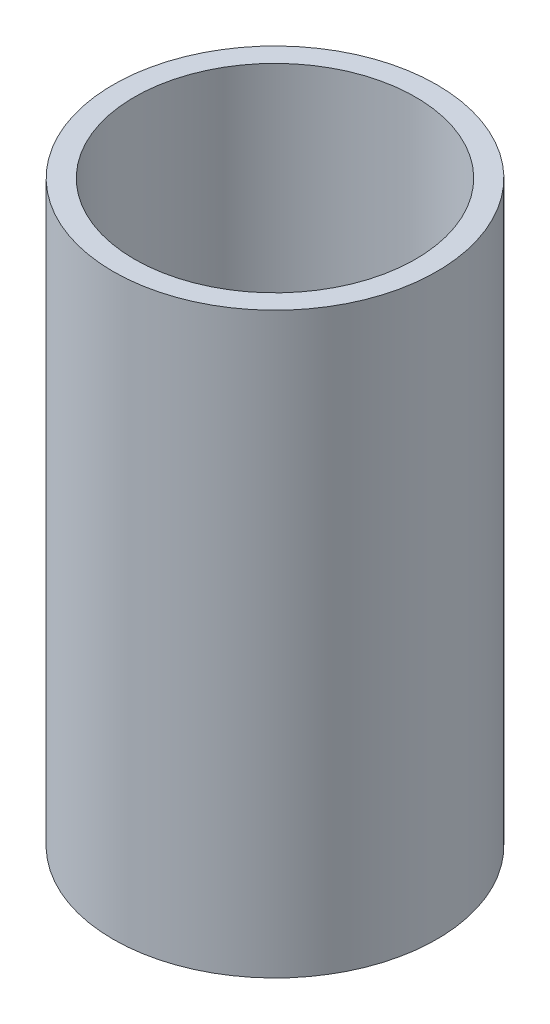
from build123d import *

# Parameters (mm, degrees)
SKETCH1_R           = 40
BOSS_EXTRUDE1_DEPTH = 142.93914418
SKETCH2_R           = 34.736296293
CUT_EXTRUDE1_DEPTH  = 154.72572634


with BuildPart() as part:
    # Sketch1 → Boss-Extrude1 (new body)
    with BuildSketch(Plane(origin=(0, 0, 0), x_dir=(1, 0, 0), z_dir=(0, 1, 0))):
        Circle(SKETCH1_R)
    extrude(amount=BOSS_EXTRUDE1_DEPTH)

    # Sketch2 → Cut-Extrude1 (cut, through all)
    with BuildSketch(Plane(origin=(0, 0, 0), x_dir=(1, 0, 0), z_dir=(0, 1, 0))):
        Circle(SKETCH2_R)
    extrude(amount=CUT_EXTRUDE1_DEPTH, mode=Mode.SUBTRACT)


solid = part.part
